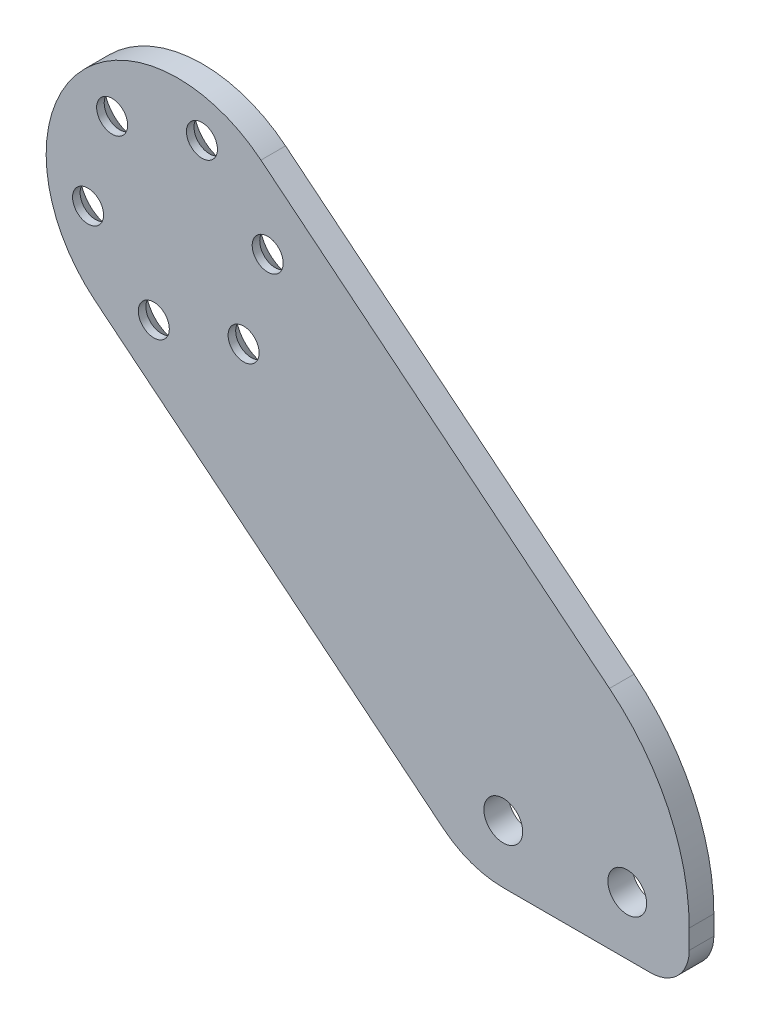
from build123d import *

# Parameters (mm, degrees)
SKETCH1_R           = 2
SKETCH1_R_2         = 2.5
BOSS_EXTRUDE1_DEPTH = 3.175
FILLET1_R           = 5
CHAMFER1_SIZE       = 2.2


with BuildPart() as part:
    # Sketch1 → Boss-Extrude1 (new body)
    with BuildSketch(Plane.XY):
        with BuildLine():
            Line((34.261326859, -49.751843123), (-10.721932331, -13.1924284))
            ThreePointArc((-10.721932331, -13.1924284), (-13.1924284, 10.721932331), (10.721932331, 13.1924284))
            Line((10.721932331, 13.1924284), (55.705191521, -23.366986323))
            ThreePointArc((55.705191521, -23.366986323), (63.295065064, -33.021160716), (66, -45))
            Line((66, -45), (66, -52.5))
            Line((66, -52.5), (42, -52.5))
            ThreePointArc((42, -52.5), (37.893924373, -51.792566974), (34.261326859, -49.751843123))
        make_face()
        with Locations((-8.485281374, 8.485281374)):
            Circle(SKETCH1_R, mode=Mode.SUBTRACT)
        with Locations((3.105828541, 11.591109915)):
            Circle(SKETCH1_R, mode=Mode.SUBTRACT)
        with Locations((11.591109915, 3.105828541)):
            Circle(SKETCH1_R, mode=Mode.SUBTRACT)
        with Locations((8.485281374, -8.485281374)):
            Circle(SKETCH1_R, mode=Mode.SUBTRACT)
        with Locations((42, -45)):
            Circle(SKETCH1_R_2, mode=Mode.SUBTRACT)
        with Locations((58, -45)):
            Circle(SKETCH1_R_2, mode=Mode.SUBTRACT)
        with Locations((-3.105828541, -11.591109915)):
            Circle(SKETCH1_R, mode=Mode.SUBTRACT)
        with Locations((-11.591109915, -3.105828541)):
            Circle(SKETCH1_R, mode=Mode.SUBTRACT)
    extrude(amount=BOSS_EXTRUDE1_DEPTH)

    # Fillet1
    fillet1_edges = [part.edges().sort_by_distance(p)[0] for p in [
        (66, -52.5, 1.5875),
    ]]
    fillet(fillet1_edges, radius=FILLET1_R)

    # Chamfer1
    chamfer1_edges = [part.edges().sort_by_distance(p)[0] for p in [
        (6.485281374, -8.485281374, 0),
        (-5.105828541, -11.591109915, 0),
        (-13.591109915, -3.105828541, 0),
        (-10.485281374, 8.485281374, 0),
        (1.105828541, 11.591109915, 0),
        (9.591109915, 3.105828541, 0),
    ]]
    chamfer(chamfer1_edges, length=CHAMFER1_SIZE)


solid = part.part
